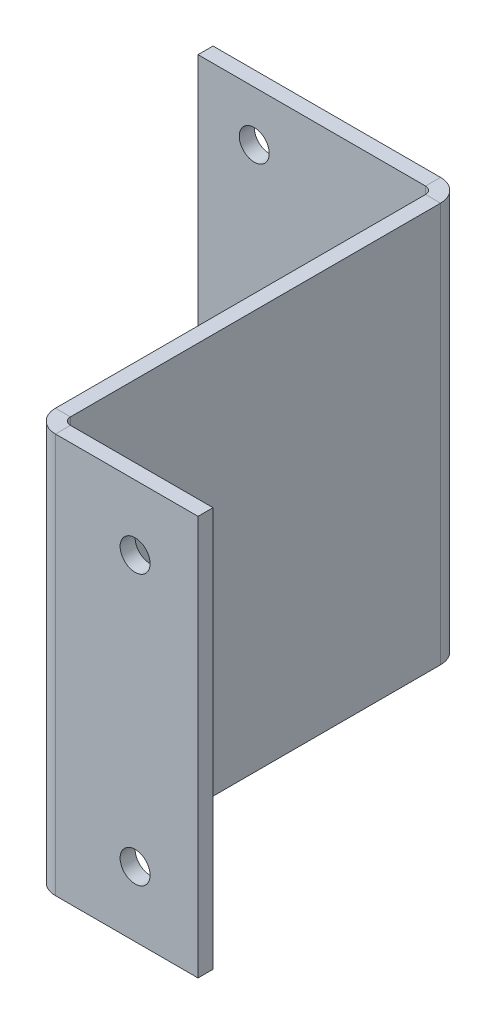
from build123d import *

# Parameters (mm, degrees)
BASE_FLANGE1_DEPTH          = 40
F_3_0MM_PRESS_DOWEL_HOLE1_D = 3
F_3_0MM_PRESS_DOWEL_HOLE2_D = 3


# Sheet-metal steps are written as plain solids
with BuildPart() as part:
    # Sketch1 → Base-Flange1 (new body)
    with BuildSketch(Plane(origin=(0, 0, 0), x_dir=(1, 0, 0), z_dir=(0, 1, 0))):
        with BuildLine():
            Line((0, 0), (22.7634, 0))
            ThreePointArc((22.7634, 0), (24.344915027, -0.655084973), (25, -2.2366))
            Line((25, -2.2366), (25, -39.2634))
            ThreePointArc((25, -39.2634), (25.215745145, -39.784254855), (25.7366, -40))
            Line((25.7366, -40), (40, -40))
            Line((40, -40), (40, -41.5))
            Line((40, -41.5), (25.7366, -41.5))
            ThreePointArc((25.7366, -41.5), (24.155084973, -40.844915027), (23.5, -39.2634))
            Line((23.5, -39.2634), (23.5, -2.2366))
            ThreePointArc((23.5, -2.2366), (23.284254855, -1.715745145), (22.7634, -1.5))
            Line((22.7634, -1.5), (0, -1.5))
            Line((0, -1.5), (0, 0))
        make_face()
    extrude(amount=BASE_FLANGE1_DEPTH)

    # Ø3.0mm Press Dowel Hole1 (through all)
    with Locations(Plane(origin=(0, 0, 40), x_dir=(-1, 0, 0), z_dir=(0, 0, -1))):
        with Locations((-33.705752928, 33.5), (-33.705752928, 6.5)):
            Hole(F_3_0MM_PRESS_DOWEL_HOLE1_D / 2)

    # Ø3.0mm Press Dowel Hole2 (through all)
    with Locations(Plane(origin=(0, 0, 0), x_dir=(-1, 0, 0), z_dir=(0, 0, -1))):
        with Locations((-5.626733286, 35), (-5.626733286, 5), (-5.626733286, 20)):
            Hole(F_3_0MM_PRESS_DOWEL_HOLE2_D / 2)


solid = part.part
